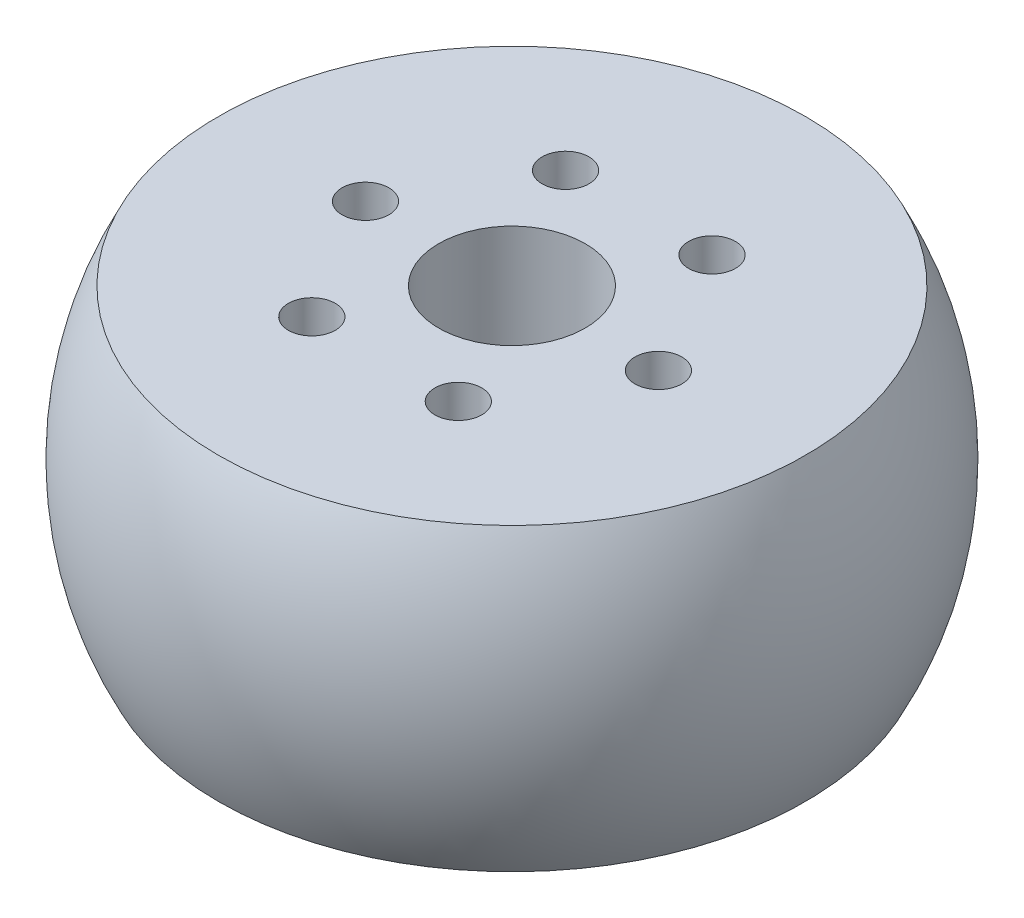
from build123d import *

# Parameters (mm, degrees)
SKETCH3_R          = 1.016
CUT_EXTRUDE1_DEPTH = 22.225345992
CIRPATTERN1_COUNT  = 6


with BuildPart() as part:
    # Sketch1 → Revolve1 (revolve)
    with BuildSketch(Plane(origin=(0, 0, 0), x_dir=(0, 0, -1), z_dir=(1, 0, 0))):
        with BuildLine():
            Line((3.175, 6.5), (12.723311528, 6.5))
            ThreePointArc((12.723311528, 6.5), (14.2875, 0), (12.723311528, -6.5))
            Line((12.723311528, -6.5), (3.175, -6.5))
            Line((3.175, -6.5), (3.175, 6.5))
        make_face()
    revolve(axis=Axis((0, -6.5, 0), (0, 1, 0)))

    # Sketch3 → Cut-Extrude1 (cut, symmetric)
    with BuildSketch(Plane(origin=(0, 0, 0), x_dir=(1, 0, 0), z_dir=(0, 1, 0))):
        with Locations((6.35, 0)):
            Circle(SKETCH3_R)
    cut_extrude1 = extrude(amount=CUT_EXTRUDE1_DEPTH, both=True, mode=Mode.SUBTRACT)

    # CirPattern1: Cut-Extrude1 ×6 about axis
    cirpattern1_axis = Axis((0, -6.5, 0), (0, -1, 0))
    for i in range(1, CIRPATTERN1_COUNT):
        add(cut_extrude1.rotate(cirpattern1_axis, i * 360 / CIRPATTERN1_COUNT), mode=Mode.SUBTRACT)


solid = part.part
